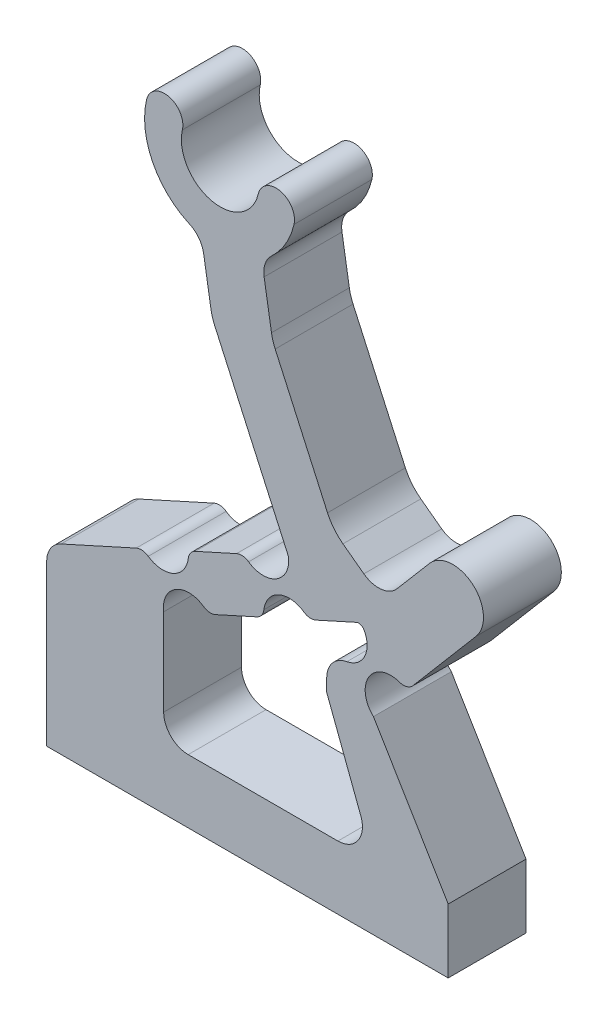
from build123d import *

# Parameters (mm, degrees)
BOSS_CONFIGUP_DEPTH = 1.5875
FILLET1_R           = 1
FILLET2_R           = 1
FILLET3_R           = 0.5
FILLET4_R           = 0.25
FILLET5_R           = 2
FILLET7_R           = 1


with BuildPart() as part:
    # Sketch-ConfigUp → Boss-ConfigUp (new, symmetric)
    with BuildSketch(Plane.XY):
        with BuildLine():
            Line((8.036884771, -1.932633536), (5.768256233, -2.958998264))
            ThreePointArc((5.768256233, -2.958998264), (5.166306437, -4.054514783), (3.946064636, -3.783387604))
            Line((3.946064636, -3.783387604), (0, -5.568651912))
            Line((0, -5.568651912), (0, -12.738236644))
            Line((0, -12.738236644), (16.372100646, -12.738236644))
            Line((16.372100646, -12.738236644), (16.372100646, -10.126726416))
            Line((16.372100646, -10.126726416), (13.32406834, -5.02866566))
            ThreePointArc((13.32406834, -5.02866566), (13.235492103, -3.587430718), (14.672142717, -3.442382733))
            Line((14.672142717, -3.442382733), (17.513873441, -0.098510164))
            ThreePointArc((17.513873441, -0.098510164), (17.370838202, 1.663460585), (15.608867453, 1.520425346))
            Line((15.608867453, 1.520425346), (13.685572067, -0.742721767))
            Line((13.685572067, -0.742721767), (11.665230115, 0.757902988))
            Line((11.665230115, 0.757902988), (9.20945182, 6.186040346))
            Line((9.20945182, 6.186040346), (8.77136122, 8.849335746))
            ThreePointArc((8.77136122, 8.849335746), (9.609835457, 9.662661067), (10.086138806, 10.729278263))
            ThreePointArc((10.086138806, 10.729278263), (9.52657217, 11.630324976), (8.625525457, 11.07075834))
            ThreePointArc((8.625525457, 11.07075834), (6.718309914, 9.886342294), (5.533893867, 11.793557837))
            ThreePointArc((5.533893867, 11.793557837), (4.974327231, 12.69460455), (4.073280517, 12.135037914))
            ThreePointArc((4.073280517, 12.135037914), (4.437375542, 9.835058641), (6.304511976, 8.443558952))
            Line((6.304511976, 8.443558952), (6.742602576, 5.780263553))
            Line((6.742602576, 5.780263553), (9.859076368, -1.108244196))
            ThreePointArc((9.859076368, -1.108244196), (9.257126572, -2.203760715), (8.036884771, -1.932633536))
        make_face()
        with BuildLine():
            Line((8.861274111, -3.754825133), (6.592645572, -4.781189861))
            ThreePointArc((6.592645572, -4.781189861), (5.372403771, -4.510062682), (4.770453975, -5.605579201))
            Line((4.770453975, -5.605579201), (4.770453975, -10.149803039))
            Line((4.770453975, -10.149803039), (6.154904632, -10.149803039))
            Line((6.154904632, -10.149803039), (11.419062352, -10.149803039))
            Line((11.419062352, -10.149803039), (13.32406834, -10.149803039))
            Line((13.32406834, -10.149803039), (11.419062352, -5.128381701))
            Line((11.419062352, -5.128381701), (11.419062352, -3.40973015))
            ThreePointArc((11.419062352, -3.40973015), (12.78717247, -3.341145376), (12.803247984, -1.971411553))
            Line((12.803247984, -1.971411553), (10.683465708, -2.930435793))
            ThreePointArc((10.683465708, -2.930435793), (9.463223907, -2.659308614), (8.861274111, -3.754825133))
        make_face(mode=Mode.SUBTRACT)
    extrude(amount=BOSS_CONFIGUP_DEPTH, both=True)

    # Fillet1
    fillet1_edges = [part.edges().sort_by_distance(p)[0] for p in [
        (8.77136122, 8.849335746, 0),
        (6.304511976, 8.443558952, 0),
        (0, -5.568651912, 0),
        (13.685572067, -0.742721767, 0),
    ]]
    fillet(fillet1_edges, radius=FILLET1_R)

    # Fillet2
    fillet2_edges = [part.edges().sort_by_distance(p)[0] for p in [
        (11.419062352, -3.40973015, 0),
    ]]
    fillet(fillet2_edges, radius=FILLET2_R)

    # Fillet3
    fillet3_edges = [part.edges().sort_by_distance(p)[0] for p in [
        (14.672142717, -3.442382733, 0),
        (3.946064636, -3.783387604, 0),
        (6.592645572, -4.781189861, 0),
        (8.861274111, -3.754825133, 0),
        (8.036884771, -1.932633536, 0),
        (5.768256233, -2.958998264, 0),
        (10.683465708, -2.930435793, 0),
    ]]
    fillet(fillet3_edges, radius=FILLET3_R)

    # Fillet4
    fillet4_edges = [part.edges().sort_by_distance(p)[0] for p in [
        (9.859076368, -1.108244196, 0),
        (12.803247984, -1.971411553, 0),
    ]]
    fillet(fillet4_edges, radius=FILLET4_R)

    # Fillet5
    fillet5_edges = [part.edges().sort_by_distance(p)[0] for p in [
        (11.665230115, 0.757902988, 0),
        (9.20945182, 6.186040346, 0),
        (6.742602576, 5.780263553, 0),
    ]]
    fillet(fillet5_edges, radius=FILLET5_R)

    # Fillet7
    fillet7_edges = [part.edges().sort_by_distance(p)[0] for p in [
        (13.32406834, -10.149803039, 0),
        (4.770453975, -10.149803039, 0),
    ]]
    fillet(fillet7_edges, radius=FILLET7_R)


solid = part.part
